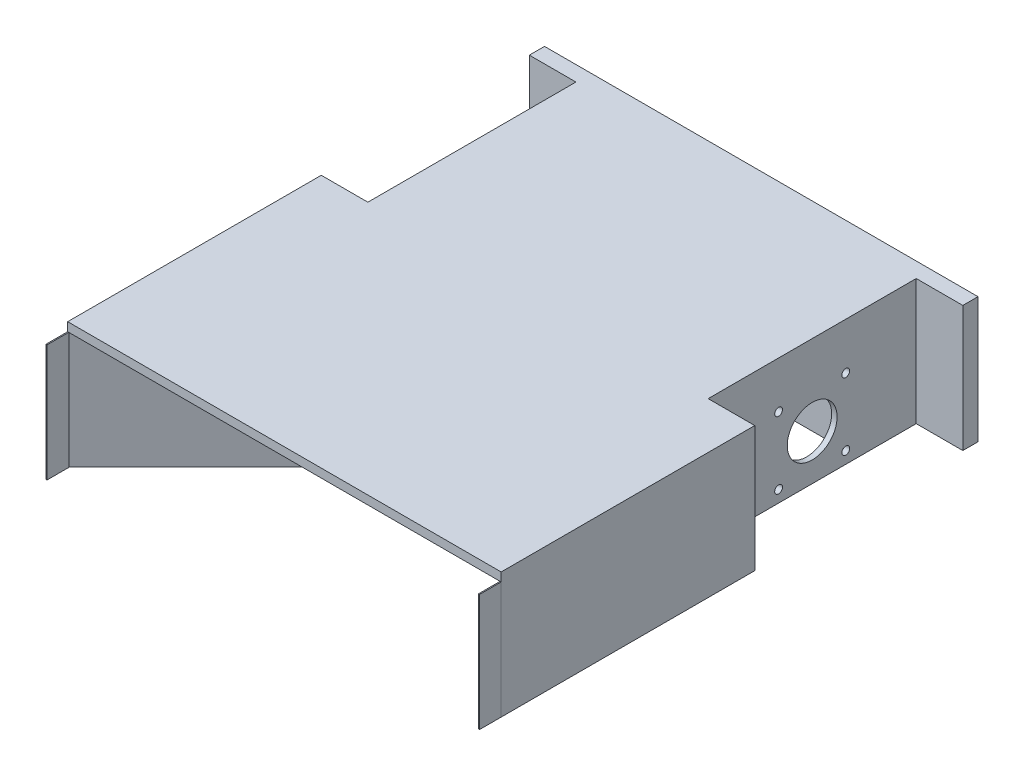
from build123d import *

# Parameters (mm, degrees)
SKETCH_1_W              = 200
SKETCH_1_H              = 220
EXTRUDE_1_DEPTH         = 4
EXTRUDE_2_DEPTH         = 54
SKETCH_1_5_W            = 0.5
SKETCH_1_5_H            = 10
EXTRUDE_3_DEPTH         = 54
EXTRUDE_3_2_DEPTH       = 54
CUT_EXTRUDE_2_DEPTH     = 303.925733473
CUT_EXTRUDE_3_DEPTH     = 42
SKETCH_7_R              = 1.8
SKETCH_7_R_2            = 11.5
CUT_EXTRUDE_4_DEPTH     = 287.865822293
MIRROR_START            = 176
MIRROR_1_OUTLINE_R      = 1.8
MIRROR_1_OUTLINE_R_2    = 11.5
MIRROR_1_DEPTH          = 2.5
CUT_EXTRUDE_START       = -21
CUT_EXTRUDE_5_OUTLINE_W = 34
CUT_EXTRUDE_5_OUTLINE_H = 16
CUT_EXTRUDE_5_DEPTH     = 21
CUT_EXTRUDE_START_2     = -6
CUT_EXTRUDE_6_OUTLINE_W = 34
CUT_EXTRUDE_6_OUTLINE_H = 24
CUT_EXTRUDE_6_DEPTH     = 6
SKETCH_11_R             = 32
CUT_EXTRUDE_7_DEPTH     = 10


# Read off the part's stored shape, not the designer's step: 镜向1, 切除-拉伸5, 切除-拉伸6
with BuildPart() as part:
    # 草图1 → 凸台-拉伸1 (new body)
    with BuildSketch(Plane(origin=(0, 0, 0), x_dir=(1, 0, 0), z_dir=(0, 1, 0))):
        with Locations((100, 110)):
            Rectangle(SKETCH_1_W, SKETCH_1_H)
    extrude(amount=EXTRUDE_1_DEPTH)

    # 草图1<4> → 凸台-拉伸2 (add)
    with BuildSketch(Plane(origin=(0, 0, 0), x_dir=(1, 0, 0), z_dir=(0, 1, 0))):
        Polygon((0, 220), (0, 0), (75, 75), (75, 220), align=None)
        Polygon((125, 220), (125, 75), (200, 0), (200, 220), align=None)
    extrude(amount=-EXTRUDE_2_DEPTH)

    # 草图3 → 切除-拉伸2 (cut, through all)
    with BuildSketch(Plane.XZ.offset(54)):
        Polygon((21.5, -186), (21.5, -165), (21.5, -144), (21.5, -117), (0, -117), (0, -213), (21.5, -213), align=None)
        Polygon((178.5, -117), (200, -117), (200, -213), (178.5, -213), (178.5, -165), align=None)
    extrude(amount=-CUT_EXTRUDE_2_DEPTH, mode=Mode.SUBTRACT)

    # 草图5 → 切除-拉伸3 (cut)
    with BuildSketch(Plane.XZ.offset(54)):
        Polygon((176, -165), (176, -144), (125, -144), (125, -186), (176, -186), align=None)
        Polygon((24, -165), (24, -144), (75, -144), (75, -186), (24, -186), align=None)
    extrude(amount=-CUT_EXTRUDE_3_DEPTH, mode=Mode.SUBTRACT)

    # 草图7 → 切除-拉伸4 (cut, through all)
    with BuildSketch(Plane(origin=(24, 0, 0), x_dir=(0, 0, -1), z_dir=(1, 0, 0))):
        with Locations((180.5, -17.5)):
            Circle(SKETCH_7_R)
        with Locations((149.5, -17.5)):
            Circle(SKETCH_7_R)
        with Locations((165, -33)):
            Circle(SKETCH_7_R_2)
        with Locations((180.5, -48.5)):
            Circle(SKETCH_7_R)
        with Locations((149.5, -48.5)):
            Circle(SKETCH_7_R)
    extrude(amount=-CUT_EXTRUDE_4_DEPTH, mode=Mode.SUBTRACT)

    # 镜向1 outline → 镜向1 (cut)
    with BuildSketch(Plane.YZ.offset(MIRROR_START)):
        with Locations((-17.5, -180.5)):
            Circle(MIRROR_1_OUTLINE_R)
        with Locations((-17.5, -149.5)):
            Circle(MIRROR_1_OUTLINE_R)
        with Locations((-33, -165)):
            Circle(MIRROR_1_OUTLINE_R_2)
        with Locations((-48.5, -180.5)):
            Circle(MIRROR_1_OUTLINE_R)
        with Locations((-48.5, -149.5)):
            Circle(MIRROR_1_OUTLINE_R)
    extrude(amount=MIRROR_1_DEPTH, mode=Mode.SUBTRACT)

    # 切除-拉伸5 outline → 切除-拉伸5 (cut)
    with BuildSketch(Plane(origin=(75, 0, 0), x_dir=(0, 0, -1), z_dir=(1, 0, 0)).offset(CUT_EXTRUDE_START)):
        with Locations((203, -33)):
            Rectangle(CUT_EXTRUDE_5_OUTLINE_W, CUT_EXTRUDE_5_OUTLINE_H)
    extrude(amount=CUT_EXTRUDE_5_DEPTH, mode=Mode.SUBTRACT)

    # 切除-拉伸6 outline → 切除-拉伸6 (cut)
    with BuildSketch(Plane.ZY.offset(-125).offset(CUT_EXTRUDE_START_2)):
        with Locations((-203, -33)):
            Rectangle(CUT_EXTRUDE_6_OUTLINE_W, CUT_EXTRUDE_6_OUTLINE_H)
    extrude(amount=CUT_EXTRUDE_6_DEPTH, mode=Mode.SUBTRACT)

    # 草图11 → 切除-拉伸7 (cut)
    with BuildSketch(Plane.XZ.offset(54)):
        with BuildLine():
            Line((75, -75), (57.681724795, -57.681724795))
            ThreePointArc((57.681724795, -57.681724795), (15.871709919, -99.491739671), (75, -99.491739671))
            Line((75, -99.491739671), (75, -75))
        make_face()
        with Locations((154.56414504, -87.245869836)):
            Circle(SKETCH_11_R)
    extrude(amount=-CUT_EXTRUDE_7_DEPTH, mode=Mode.SUBTRACT)


with BuildPart() as body_2:
    # 草图1<5> → 凸台-拉伸3 (new body)
    with BuildSketch(Plane(origin=(0, 0, 0), x_dir=(1, 0, 0), z_dir=(0, 1, 0))):
        with Locations((199.75, -5)):
            Rectangle(SKETCH_1_5_W, SKETCH_1_5_H)
    extrude(amount=-EXTRUDE_3_DEPTH)


with BuildPart() as body_3:
    # 草图1<5> → Extrude 3 2 (new body)
    with BuildSketch(Plane(origin=(0, 0, 0), x_dir=(1, 0, 0), z_dir=(0, 1, 0))):
        with Locations((0.25, -5)):
            Rectangle(SKETCH_1_5_W, SKETCH_1_5_H)
    extrude(amount=-EXTRUDE_3_2_DEPTH)


solid = Compound([part.part, body_2.part, body_3.part])
